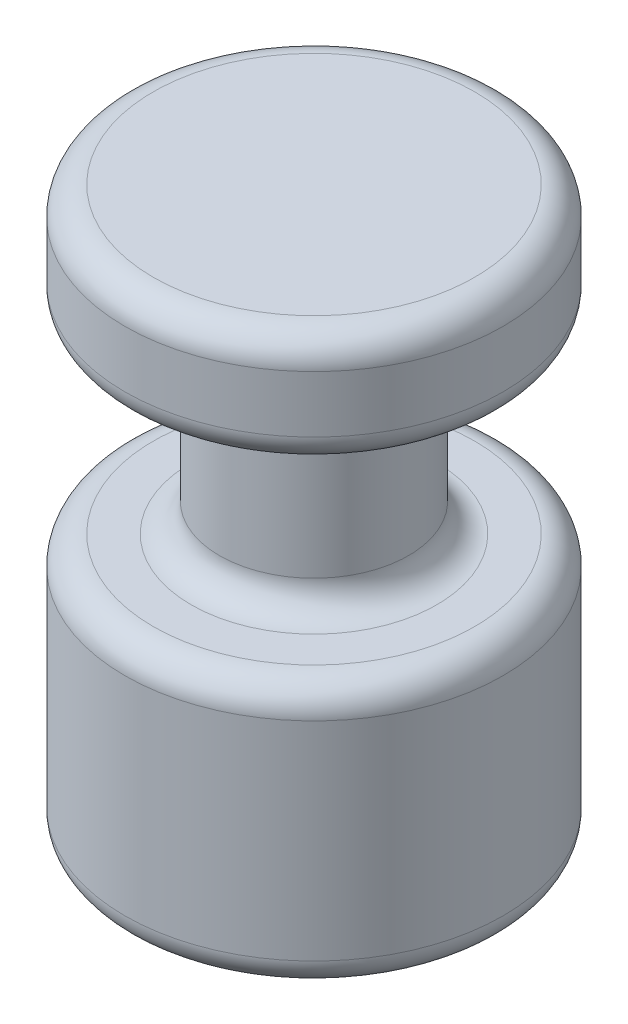
from build123d import *

# Parameters (mm, degrees)
SKETCH1_R           = 5
SKETCH1_W           = 5
SKETCH1_H           = 5
BOSS_EXTRUDE1_DEPTH = 5
SKETCH2_R           = 5
BOSS_EXTRUDE2_DEPTH = 2
SKETCH3_R           = 2.5
BOSS_EXTRUDE3_DEPTH = 5
SKETCH4_R           = 5
BOSS_EXTRUDE4_DEPTH = 3
FILLET7_R           = 0.75


with BuildPart() as part:
    # Sketch1 → Boss-Extrude1 (new body)
    with BuildSketch(Plane(origin=(0, 0, 0), x_dir=(1, 0, 0), z_dir=(0, 1, 0))):
        Circle(SKETCH1_R)
        Rectangle(SKETCH1_W, SKETCH1_H, mode=Mode.SUBTRACT)
    extrude(amount=BOSS_EXTRUDE1_DEPTH)

    # Sketch2 → Boss-Extrude2 (add)
    with BuildSketch(Plane(origin=(0, 5, 0), x_dir=(1, 0, 0), z_dir=(0, 1, 0))):
        Circle(SKETCH2_R)
    extrude(amount=BOSS_EXTRUDE2_DEPTH)

    # Sketch3 → Boss-Extrude3 (add)
    with BuildSketch(Plane(origin=(0, 7, 0), x_dir=(1, 0, 0), z_dir=(0, 1, 0))):
        Circle(SKETCH3_R)
    extrude(amount=BOSS_EXTRUDE3_DEPTH)

    # Sketch4 → Boss-Extrude4 (add)
    with BuildSketch(Plane(origin=(0, 12, 0), x_dir=(1, 0, 0), z_dir=(0, 1, 0))):
        Circle(SKETCH4_R)
    extrude(amount=BOSS_EXTRUDE4_DEPTH)

    # Fillet7
    fillet7_edges = [part.edges().sort_by_distance(p)[0] for p in [
        (-5, 15, 0),
        (-5, 12, 0),
        (-2.5, 12, 0),
        (0, 5, 2.5),
        (0, 0, 2.5),
        (2.5, 5, 0),
        (2.5, 2.5, 2.5),
        (2.5, 0, 0),
        (0, 5, -2.5),
        (2.5, 2.5, -2.5),
        (0, 0, -2.5),
        (-2.5, 2.5, 2.5),
        (-2.5, 5, 0),
        (-2.5, 2.5, -2.5),
        (-2.5, 0, 0),
        (-5, 0, 0),
        (-2.5, 7, 0),
        (-5, 7, 0),
    ]]
    fillet(fillet7_edges, radius=FILLET7_R)


solid = part.part
